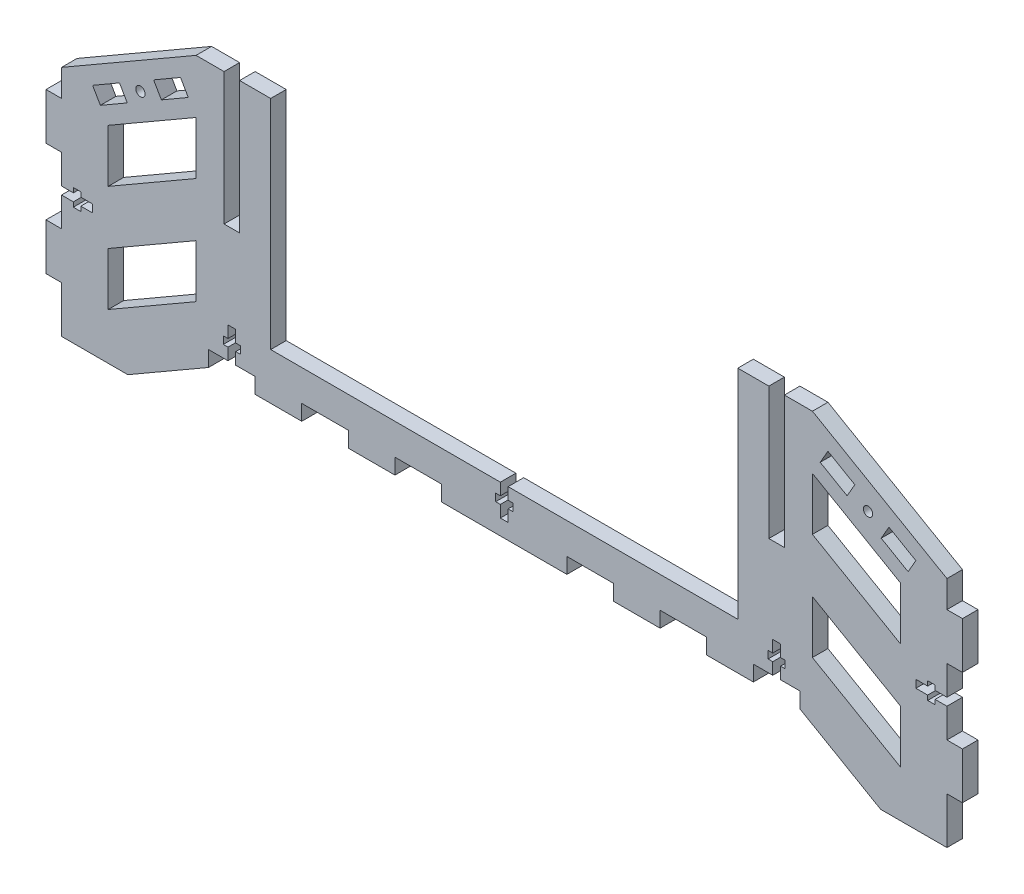
from build123d import *

# Parameters (mm, degrees)
ESTRUSIONE_ESTRUSIONE1_DEPTH = 5
SCHIZZO2_R                   = 1.5
TAGLIO_ESTRUSIONE2_DEPTH     = 179.27296486
SCHIZZO5_W                   = 15
SCHIZZO5_H                   = 5
SCHIZZO5_W_2                 = 5
SCHIZZO5_H_2                 = 42.5
SCHIZZO5_W_3                 = 150.358983848
SCHIZZO5_H_3                 = 70
TAGLIO_ESTRUSIONE3_DEPTH     = 179.27296486
TAGLIO_ESTRUSIONE4_DEPTH     = 179.27296486


with BuildPart() as part:
    # Schizzo1 → Estrusione-Estrusione1 (new body)
    with BuildSketch(Plane.XY):
        Polygon((-142.5, 75), (-142.5, 66.339745962), (-147.5, 66.339745962), (-147.5, 51.339745962), (-142.5, 51.339745962), (-142.5, 30), (-147.5, 30), (-147.5, 15), (-142.5, 15), (-142.5, 0), (142.5, 0), (142.5, 15), (147.5, 15), (147.5, 30), (142.5, 30), (142.5, 51.339745962), (147.5, 51.339745962), (147.5, 66.339745962), (142.5, 66.339745962), (142.5, 75), (99.198729811, 100), (-99.198729811, 100), align=None)
    extrude(amount=ESTRUSIONE_ESTRUSIONE1_DEPTH)

    # Schizzo2 → Taglio-Estrusione2 (cut, through all)
    with BuildSketch(Plane.XY):
        with Locations((-117.099364905, 81.004809472)):
            Circle(SCHIZZO2_R)
        with Locations((117.099364905, 81.004809472)):
            Circle(SCHIZZO2_R)
        Polygon((-99.198729811, 82.679491924), (-127.5, 66.339745962), (-127.5, 49.330127019), (-99.198729811, 65.669872981), align=None)
        Polygon((99.198729811, 31.339745962), (99.198729811, 48.349364905), (127.5, 32.009618943), (127.5, 15), align=None)
        Polygon((-95.179491924, 15), (-121.160254038, 0), (121.160254038, 0), (95.179491924, 15), align=None)
        Polygon((-99.198729811, 31.339745962), (-127.5, 15), (-127.5, 32.009618943), (-99.198729811, 48.349364905), align=None)
        Polygon((99.198729811, 65.669872981), (99.198729811, 82.679491924), (127.5, 66.339745962), (127.5, 49.330127019), align=None)
        Polygon((-132.5, 75), (-123.839745962, 80), (-121.339745962, 75.669872981), (-130, 70.669872981), align=None)
        Polygon((-104.198729811, 91.339745962), (-101.698729811, 87.009618943), (-110.358983849, 82.009618943), (-112.858983849, 86.339745962), align=None)
        Polygon((132.5, 75), (130, 70.669872981), (121.339745962, 75.669872981), (123.839745962, 80), align=None)
        Polygon((104.198729811, 91.339745962), (112.858983849, 86.339745962), (110.358983849, 82.009618943), (101.698729811, 87.009618943), align=None)
    extrude(amount=TAGLIO_ESTRUSIONE2_DEPTH, mode=Mode.SUBTRACT)

    # Schizzo5 → Taglio-Estrusione3 (cut, through all)
    with BuildSketch(Plane.XY):
        with Locations((-87.679491924, 17.5)):
            Rectangle(SCHIZZO5_W, SCHIZZO5_H)
        with Locations((-57.679491924, 17.5)):
            Rectangle(SCHIZZO5_W, SCHIZZO5_H)
        with Locations((-27.679491924, 17.5)):
            Rectangle(SCHIZZO5_W, SCHIZZO5_H)
        with Locations((27.679491924, 17.5)):
            Rectangle(SCHIZZO5_W, SCHIZZO5_H)
        with Locations((57.679491924, 17.5)):
            Rectangle(SCHIZZO5_W, SCHIZZO5_H)
        with Locations((87.679491924, 17.5)):
            Rectangle(SCHIZZO5_W, SCHIZZO5_H)
        with Locations((87.679491924, 78.75)):
            Rectangle(SCHIZZO5_W_2, SCHIZZO5_H_2)
        with Locations((-87.679491924, 78.75)):
            Rectangle(SCHIZZO5_W_2, SCHIZZO5_H_2)
        with Locations((0, 65)):
            Rectangle(SCHIZZO5_W_3, SCHIZZO5_H_3)
    extrude(amount=TAGLIO_ESTRUSIONE3_DEPTH, mode=Mode.SUBTRACT)

    # Schizzo6 → Taglio-Estrusione4 (cut, through all)
    with BuildSketch(Plane.XY):
        Polygon((-142.5, 41.919872981), (-138.7, 41.919872981), (-138.7, 43.419872981), (-136.3, 43.419872981), (-136.3, 41.919872981), (-132.5, 41.919872981), (-132.5, 39.419872981), (-136.3, 39.419872981), (-136.3, 37.919872981), (-138.7, 37.919872981), (-138.7, 39.419872981), (-142.5, 39.419872981), align=None)
        Polygon((136.3, 43.419872981), (136.3, 41.919872981), (132.5, 41.919872981), (132.5, 39.419872981), (136.3, 39.419872981), (136.3, 37.919872981), (138.7, 37.919872981), (138.7, 39.419872981), (142.5, 39.419872981), (142.5, 41.919872981), (138.7, 41.919872981), (138.7, 43.419872981), align=None)
        Polygon((-88.929491924, 20), (-88.929491924, 23.8), (-90.429491924, 23.8), (-90.429491924, 26.2), (-88.929491924, 26.2), (-88.929491924, 30), (-86.429491924, 30), (-86.429491924, 26.2), (-84.929491924, 26.2), (-84.929491924, 23.8), (-86.429491924, 23.8), (-86.429491924, 20), align=None)
        Polygon((86.429491924, 20), (88.929491924, 20), (88.929491924, 23.8), (90.429491924, 23.8), (90.429491924, 26.2), (88.929491924, 26.2), (88.929491924, 30), (86.429491924, 30), (86.429491924, 26.2), (84.929491924, 26.2), (84.929491924, 23.8), (86.429491924, 23.8), align=None)
        Polygon((-1.25, 20), (-1.25, 23.8), (-2.75, 23.8), (-2.75, 26.2), (-1.25, 26.2), (-1.25, 30), (1.25, 30), (1.25, 26.2), (2.75, 26.2), (2.75, 23.8), (1.25, 23.8), (1.25, 20), align=None)
    extrude(amount=TAGLIO_ESTRUSIONE4_DEPTH, mode=Mode.SUBTRACT)


solid = part.part
